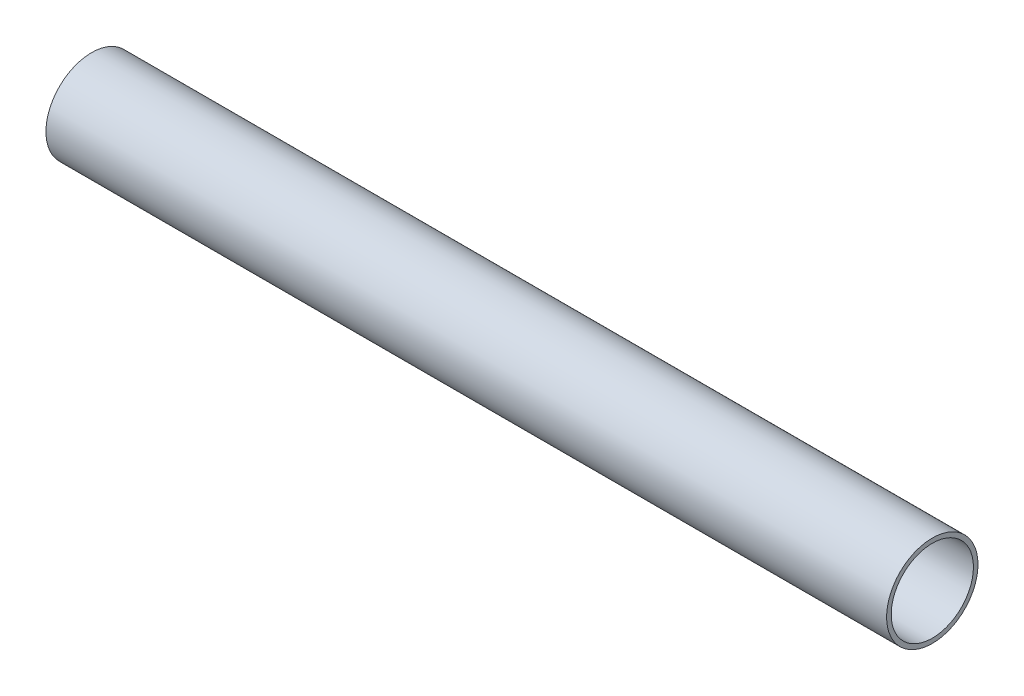
from build123d import *

# Parameters (mm, degrees)
SKETCH1_R           = 15.875
SKETCH1_R_2         = 14.2875
EXTRUDE_THIN1_DEPTH = 146.05


with BuildPart() as part:
    # Sketch1 → Extrude-Thin1 (new, symmetric)
    with BuildSketch(Plane(origin=(0, 0, 0), x_dir=(0, 0, -1), z_dir=(1, 0, 0))):
        Circle(SKETCH1_R)
        Circle(SKETCH1_R_2, mode=Mode.SUBTRACT)
    extrude(amount=EXTRUDE_THIN1_DEPTH, both=True)


solid = part.part
